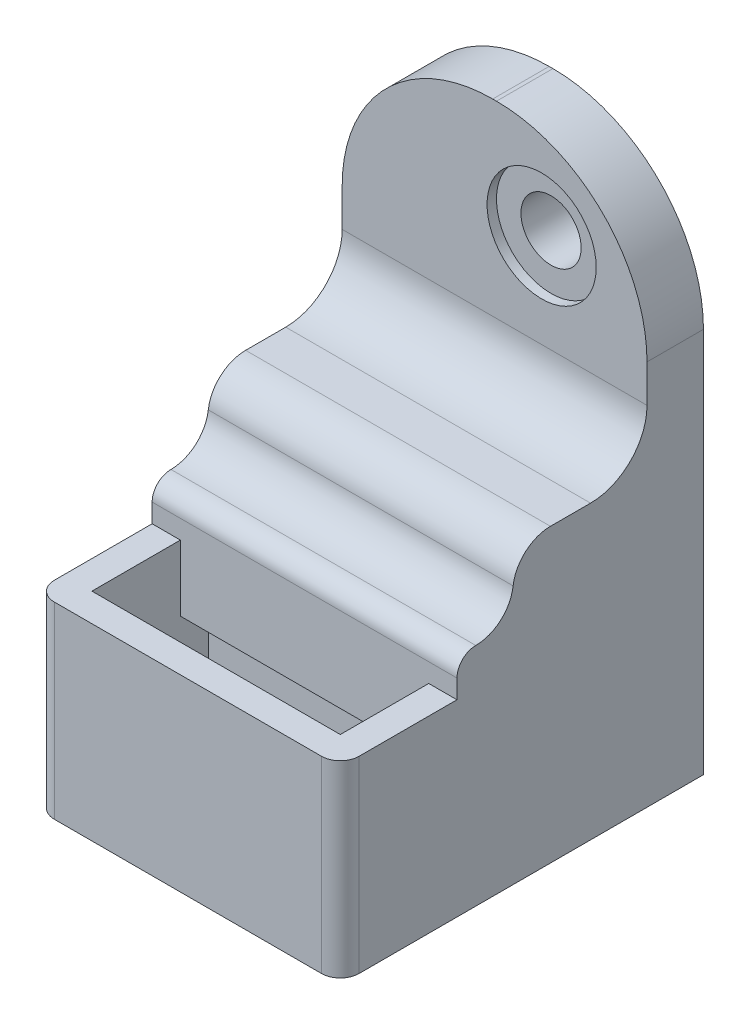
from build123d import *

# Parameters (mm, degrees)
CROQUIS2_W              = 16.2
CROQUIS2_H              = 9.2
CROQUIS2_W_2            = 13.2
CROQUIS2_H_2            = 6.2
SALIENTE_EXTRUIR1_DEPTH = 6.5
CROQUIS3_W              = 16.2
CROQUIS3_H              = 12
SALIENTE_EXTRUIR2_DEPTH = 2
SALIENTE_EXTRUIR3_DEPTH = 8.1
CROQUIS5_W              = 16.2
CROQUIS5_H              = 3
SALIENTE_EXTRUIR4_DEPTH = 13
CROQUIS6_R              = 1.6
CORTAR_EXTRUIR1_DEPTH   = 3
CROQUIS7_W              = 16.2
CROQUIS7_H              = 2
SALIENTE_EXTRUIR5_DEPTH = 3
CROQUIS8_R              = 2.9
CORTAR_EXTRUIR2_DEPTH   = 0.5
REDONDEO1_R             = 1
REDONDEO2_R             = 1
REDONDEO3_R             = 2
REDONDEO4_R             = 2
REDONDEO5_R             = 3
REDONDEO6_R             = 8
CROQUIS9_W              = 13.2
CROQUIS9_H              = 6.2
SALIENTE_EXTRUIR6_DEPTH = 3.5
CROQUIS10_W             = 13.2
CROQUIS10_H             = 1.5
SALIENTE_EXTRUIR7_DEPTH = 3.5


with BuildPart() as part:
    # Croquis2 → Saliente-Extruir1 (new body)
    with BuildSketch(Plane(origin=(0, 0, 0), x_dir=(1, 0, 0), z_dir=(0, 1, 0))):
        with Locations((6.6, -3.1)):
            Rectangle(CROQUIS2_W, CROQUIS2_H)
        with Locations((6.6, -3.1)):
            Rectangle(CROQUIS2_W_2, CROQUIS2_H_2, mode=Mode.SUBTRACT)
    extrude(amount=SALIENTE_EXTRUIR1_DEPTH)

    # Croquis3 → Saliente-Extruir2 (add)
    with BuildSketch(Plane(origin=(0, 0, -1.5), x_dir=(-1, 0, 0), z_dir=(0, 0, -1))):
        with Locations((-6.6, 6)):
            Rectangle(CROQUIS3_W, CROQUIS3_H)
    extrude(amount=SALIENTE_EXTRUIR2_DEPTH)

    # Croquis4 → Saliente-Extruir3 (add)
    with BuildSketch(Plane(origin=(0, 0, -3.5), x_dir=(-1, 0, 0), z_dir=(0, 0, -1))):
        Polygon((1.5, 0), (1.5, 12), (-14.7, 12), (-14.7, 0), (-12.9, 0), (-12.9, 10), (-0.3, 10), (-0.3, 0), align=None)
    extrude(amount=SALIENTE_EXTRUIR3_DEPTH)

    # Croquis5 → Saliente-Extruir4 (add)
    with BuildSketch(Plane(origin=(0, 12, 0), x_dir=(1, 0, 0), z_dir=(0, 1, 0))):
        with Locations((6.6, 10.1)):
            Rectangle(CROQUIS5_W, CROQUIS5_H)
    extrude(amount=SALIENTE_EXTRUIR4_DEPTH)

    # Croquis6 → Cortar-Extruir1 (cut)
    with BuildSketch(Plane.XY.offset(-8.6)):
        with Locations((9.1, 20)):
            Circle(CROQUIS6_R)
    extrude(amount=-CORTAR_EXTRUIR1_DEPTH, mode=Mode.SUBTRACT)

    # Croquis7 → Saliente-Extruir5 (add)
    with BuildSketch(Plane.XY.offset(-1.5)):
        with Locations((6.6, 7.5)):
            Rectangle(CROQUIS7_W, CROQUIS7_H)
    extrude(amount=SALIENTE_EXTRUIR5_DEPTH)

    # Croquis8 → Cortar-Extruir2 (cut)
    with BuildSketch(Plane.XY.offset(-8.6)):
        with Locations((9.1, 20)):
            Circle(CROQUIS8_R)
    extrude(amount=-CORTAR_EXTRUIR2_DEPTH, mode=Mode.SUBTRACT)

    # Redondeo1
    redondeo1_edges = [part.edges().sort_by_distance(p)[0] for p in [
        (14.7, 3.25, 7.7),
        (-1.5, 3.25, 7.7),
    ]]
    fillet(redondeo1_edges, radius=REDONDEO1_R)

    # Redondeo2
    redondeo2_edges = [part.edges().sort_by_distance(p)[0] for p in [
        (6.6, 8.5, 1.5),
    ]]
    fillet(redondeo2_edges, radius=REDONDEO2_R)

    # Redondeo3
    redondeo3_edges = [part.edges().sort_by_distance(p)[0] for p in [
        (6.6, 8.5, -1.5),
    ]]
    fillet(redondeo3_edges, radius=REDONDEO3_R - 0.0001)  # a hair under: the kernel refuses the full size

    # Redondeo4
    redondeo4_edges = [part.edges().sort_by_distance(p)[0] for p in [
        (6.6, 12, -1.5),
    ]]
    fillet(redondeo4_edges, radius=REDONDEO4_R)

    # Redondeo5
    redondeo5_edges = [part.edges().sort_by_distance(p)[0] for p in [
        (6.6, 12, -8.6),
    ]]
    fillet(redondeo5_edges, radius=REDONDEO5_R)

    # Redondeo6
    redondeo6_edges = [part.edges().sort_by_distance(p)[0] for p in [
        (14.7, 25, -10.1),
        (-1.5, 25, -10.1),
    ]]
    fillet(redondeo6_edges, radius=REDONDEO6_R)

    # Croquis9 → Saliente-Extruir6 (add)
    with BuildSketch(Plane.XZ):
        with BuildLine():
            Line((13.7, 7.7), (-0.5, 7.7))
            ThreePointArc((-0.5, 7.7), (-1.207106781, 7.407106781), (-1.5, 6.7))
            Line((-1.5, 6.7), (-1.5, -11.6))
            Line((-1.5, -11.6), (0.3, -11.6))
            Line((0.3, -11.6), (0.3, -3.5))
            Line((0.3, -3.5), (12.9, -3.5))
            Line((12.9, -3.5), (12.9, -11.6))
            Line((12.9, -11.6), (14.7, -11.6))
            Line((14.7, -11.6), (14.7, 6.7))
            ThreePointArc((14.7, 6.7), (14.407106781, 7.407106781), (13.7, 7.7))
        make_face()
        with Locations((6.6, 3.1)):
            Rectangle(CROQUIS9_W, CROQUIS9_H, mode=Mode.SUBTRACT)
    extrude(amount=SALIENTE_EXTRUIR6_DEPTH)

    # Croquis10 → Saliente-Extruir7 (add)
    with BuildSketch(Plane.XZ.offset(-6.5)):
        with Locations((6.6, 0.75)):
            Rectangle(CROQUIS10_W, CROQUIS10_H)
    extrude(amount=SALIENTE_EXTRUIR7_DEPTH)


solid = part.part
